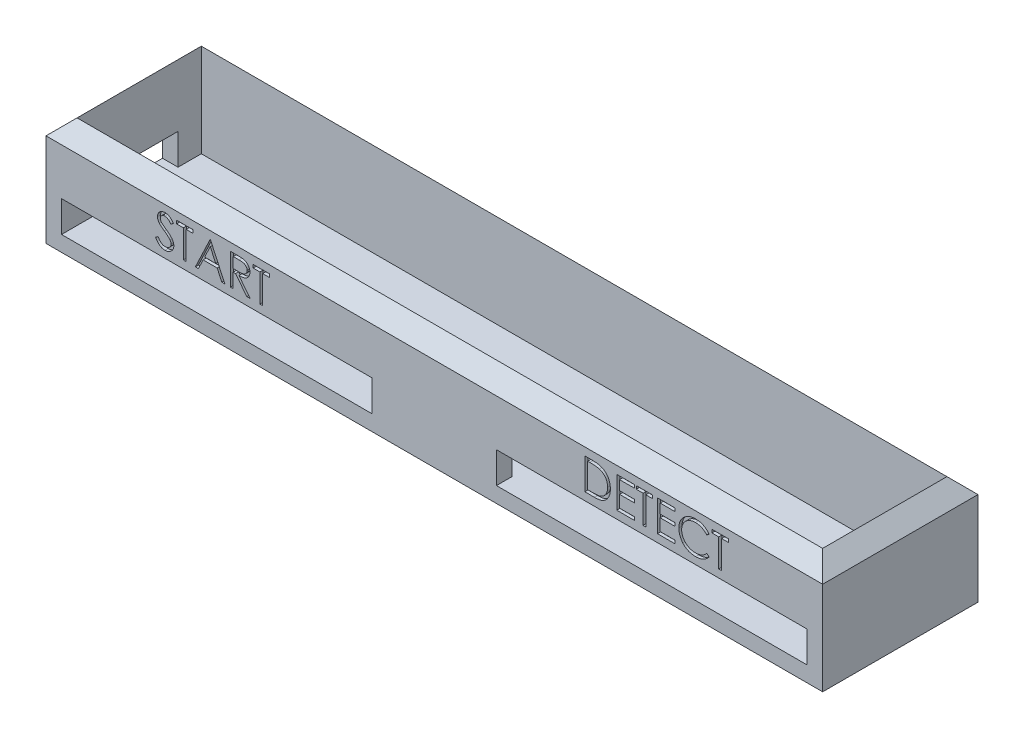
from build123d import *

# Parameters (mm, degrees)
SKETCH1_W            = 50
SKETCH1_H            = 10
BOSS_EXTRUDE1_DEPTH  = 8
SHELL1_T             = 1
CUT_EXTRUDE1_REACH   = 53.614
SKETCH2_W            = 20
SKETCH2_H            = 2
LPATTERN3_COUNT      = 2
LPATTERN3_PITCH      = 28
ARDUINO_CABLE_REACH  = 53.614
SKETCH3_W            = 5
SKETCH3_H            = 2
ARDUINO_DEBOSS_DEPTH = 0.2
DB15_LABELS_DEPTH    = 0.2
SKETCH6_W            = 50
SKETCH6_H            = 10
CUT_EXTRUDE5_DEPTH   = 1
CHAMFER1_SIZE        = 1


with BuildPart() as part:
    # Sketch1 → Boss-Extrude1 (new body)
    with BuildSketch(Plane(origin=(0, 0, 0), x_dir=(1, 0, 0), z_dir=(0, 1, 0))):
        with Locations((25, 5)):
            Rectangle(SKETCH1_W, SKETCH1_H)
    extrude(amount=BOSS_EXTRUDE1_DEPTH)

    # Shell1 (no face opened: a closed hollow body)
    add(offset(amount=-SHELL1_T, mode=Mode.PRIVATE), mode=Mode.SUBTRACT)

    # Sketch2 → Cut-Extrude1 (cut, up to next)
    with BuildSketch(Plane.XY, mode=Mode.PRIVATE) as cut_extrude1_sk1:
        with Locations((11, 2)):
            Rectangle(SKETCH2_W, SKETCH2_H)
    cut_extrude1_tool1 = extrude(cut_extrude1_sk1.sketch, amount=-CUT_EXTRUDE1_REACH, mode=Mode.PRIVATE) & part.part
    cut_extrude1 = cut_extrude1_tool1.solids().sort_by_distance((11, 2, 0))[0]
    add(cut_extrude1, mode=Mode.SUBTRACT)

    # LPattern3: Cut-Extrude1 ×2
    with Locations(*[(i * LPATTERN3_PITCH, 0, 0) for i in range(1, LPATTERN3_COUNT)]):
        add(cut_extrude1, mode=Mode.SUBTRACT)

    # Sketch3 → Arduino Cable (cut, up to next)
    with BuildSketch(Plane.ZY, mode=Mode.PRIVATE) as arduino_cable_sk1:
        with Locations((-5, 2)):
            Rectangle(SKETCH3_W, SKETCH3_H)
    arduino_cable_tool1 = extrude(arduino_cable_sk1.sketch, amount=-ARDUINO_CABLE_REACH, mode=Mode.PRIVATE) & part.part
    add(arduino_cable_tool1.solids().sort_by_distance((0, 2, -5))[0], mode=Mode.SUBTRACT)

    # Sketch4 → Arduino Deboss (cut)
    with BuildSketch(Plane.ZY):
        Polygon((-8.346153846, 3.5), (-8.08213141, 5.5), (-8.056490385, 5.5), (-7.230769231, 3.858974359), (-6.407451923, 5.5), (-6.381810897, 5.5), (-6.115384615, 3.5), (-6.294871795, 3.5), (-6.487179487, 4.937900641), (-7.208733974, 3.5), (-7.249599359, 3.5), (-7.974358974, 4.942307692), (-8.165464744, 3.5), align=None)
        with BuildLine():
            Line((-3.858974359, 5.133012821), (-4.016025641, 5.012820513))
            add(Edge.make_bspline(
                [(-4.016025641, 5.012820513), (-4.027229006, 5.026172496), (-4.04948469, 5.052696447), (-4.085289948, 5.089941901), (-4.122605173, 5.124836337), (-4.161416099, 5.157545982), (-4.20242131, 5.186926991), (-4.244627481, 5.214510478), (-4.28874065, 5.2392349), (-4.349741641, 5.269213749), (-4.429540411, 5.300497266), (-4.529994605, 5.326727684), (-4.63485809, 5.343425499), (-4.706399575, 5.34523398), (-4.742788462, 5.346153846)],
                knots=[0, 0, 0, 0, 0.757959112, 1.505699292, 2.245454638, 2.979532153, 3.711538275, 4.438200793, 5.171680507, 5.909471876, 7.393775596, 8.890124382, 10.418191784, 12, 12, 12, 12], degree=3))
            add(Edge.make_bspline(
                [(-4.742788462, 5.346153846), (-4.762836061, 5.34592301), (-4.8027452, 5.345463481), (-4.861972899, 5.339401124), (-4.920094642, 5.330880433), (-4.977072623, 5.318237391), (-5.032834314, 5.302253037), (-5.087744258, 5.283152801), (-5.141007458, 5.259521463), (-5.193360737, 5.233402458), (-5.243520286, 5.203901061), (-5.290980313, 5.171722003), (-5.335567723, 5.137225376), (-5.377317787, 5.100281887), (-5.416273186, 5.061057909), (-5.45215165, 5.019135428), (-5.484829027, 4.974648472), (-5.514953041, 4.928183668), (-5.541931746, 4.879876358), (-5.564520249, 4.829547747), (-5.584523176, 4.778059688), (-5.600351314, 4.724830453), (-5.61287961, 4.670234587), (-5.621523989, 4.614125565), (-5.627517401, 4.556620605), (-5.627974645, 4.517643855), (-5.628205128, 4.497996795)],
                knots=[0, 0, 0, 0, 1.054917814, 2.100044995, 3.131103042, 4.146048494, 5.169673617, 6.183595914, 7.203665975, 8.234915748, 9.262203917, 10.264457458, 11.251630812, 12.227803204, 13.197192746, 14.159520551, 15.12972552, 16.100847026, 17.073214652, 18.039054194, 19.002613845, 19.979014051, 20.95965708, 21.949030935, 22.966165397, 24, 24, 24, 24], degree=3))
            add(Edge.make_bspline(
                [(-5.628205128, 4.497996795), (-5.627484089, 4.468436041), (-5.626068423, 4.410397421), (-5.613469375, 4.325385643), (-5.594323609, 4.243945258), (-5.565628994, 4.166585348), (-5.530246679, 4.092352001), (-5.485537758, 4.022501228), (-5.43375688, 3.955977476), (-5.374171497, 3.894352935), (-5.308796745, 3.838059377), (-5.238655081, 3.788487617), (-5.163921203, 3.747164827), (-5.085420271, 3.712778571), (-5.002548206, 3.686346156), (-4.915454033, 3.667738085), (-4.824327179, 3.655599696), (-4.76205895, 3.654437589), (-4.73036859, 3.653846154)],
                knots=[0, 0, 0, 0, 1.029171465, 2.020641659, 2.987623507, 3.938342917, 4.889210282, 5.84687017, 6.821220943, 7.821438502, 8.827599549, 9.822697543, 10.807740252, 11.797342354, 12.80366471, 13.83203677, 14.896651826, 16, 16, 16, 16], degree=3))
            add(Edge.make_bspline(
                [(-4.73036859, 3.653846154), (-4.695452767, 3.654811171), (-4.626730077, 3.656710555), (-4.525948347, 3.672801555), (-4.429470767, 3.698891793), (-4.337292146, 3.735404892), (-4.249672348, 3.782870771), (-4.166474257, 3.840412415), (-4.087627645, 3.908577176), (-4.040215484, 3.960624678), (-4.016025641, 3.987179487)],
                knots=[0, 0, 0, 0, 1.028121516, 2.023589091, 2.998037872, 3.967518031, 4.937445131, 5.927275754, 6.942489185, 8, 8, 8, 8], degree=3))
            Line((-4.016025641, 3.987179487), (-3.858974359, 3.868189103))
            add(Edge.make_bspline(
                [(-3.858974359, 3.868189103), (-3.871613279, 3.851881416), (-3.896830579, 3.819344155), (-3.937663732, 3.773474607), (-3.98067933, 3.730329443), (-4.026196879, 3.690256517), (-4.07369276, 3.652453965), (-4.124019795, 3.617995776), (-4.176516385, 3.586400985), (-4.231004659, 3.557471314), (-4.287426723, 3.531804316), (-4.345714972, 3.509830734), (-4.405618158, 3.490902226), (-4.46713902, 3.47532969), (-4.530405167, 3.463174785), (-4.595188295, 3.455049257), (-4.661628223, 3.449482449), (-4.706451893, 3.448975068), (-4.729166667, 3.448717949)],
                knots=[0, 0, 0, 0, 0.986787822, 1.968848986, 2.935600012, 3.899624008, 4.868462664, 5.837806735, 6.815139263, 7.798259679, 8.787526145, 9.778297419, 10.776456485, 11.791383307, 12.812564526, 13.85620153, 14.913611965, 16, 16, 16, 16], degree=3))
            add(Edge.make_bspline(
                [(-4.729166667, 3.448717949), (-4.750677334, 3.448867659), (-4.793212014, 3.449163692), (-4.8560113, 3.453959216), (-4.917148204, 3.460501923), (-4.97644799, 3.470353426), (-5.034234261, 3.481978763), (-5.089983167, 3.497562339), (-5.144243287, 3.515019005), (-5.196796624, 3.535536141), (-5.247687881, 3.558688245), (-5.296752916, 3.58485485), (-5.343969164, 3.613815916), (-5.389800833, 3.644933064), (-5.43357088, 3.679205808), (-5.475658609, 3.716158171), (-5.516300024, 3.755665606), (-5.541444416, 3.784154093), (-5.554086538, 3.798477564)],
                knots=[0, 0, 0, 0, 1.114604814, 2.203992996, 3.262667896, 4.300477797, 5.318619304, 6.316056647, 7.298880507, 8.271930387, 9.238335007, 10.195173496, 11.151986948, 12.108099108, 13.064862484, 14.031167946, 15.010108607, 16, 16, 16, 16], degree=3))
            add(Edge.make_bspline(
                [(-5.554086538, 3.798477564), (-5.574335478, 3.823358243), (-5.614588893, 3.872819221), (-5.666089284, 3.952982639), (-5.710173601, 4.036678758), (-5.745816984, 4.124347289), (-5.773681403, 4.21579151), (-5.792984943, 4.311057518), (-5.805528717, 4.410056342), (-5.806963168, 4.47739165), (-5.807692308, 4.51161859)],
                knots=[0, 0, 0, 0, 0.994628077, 1.977248131, 2.950237994, 3.925870899, 4.908910175, 5.911660606, 6.938484602, 8, 8, 8, 8], degree=3))
            add(Edge.make_bspline(
                [(-5.807692308, 4.51161859), (-5.806803626, 4.547593135), (-5.805055199, 4.618370806), (-5.790200459, 4.722241636), (-5.766304004, 4.821756721), (-5.732362925, 4.91673029), (-5.689331295, 5.007661878), (-5.63617323, 5.093856853), (-5.573506292, 5.175866452), (-5.501821968, 5.25244631), (-5.423212062, 5.322468797), (-5.339029882, 5.384072342), (-5.249440198, 5.435339494), (-5.155429997, 5.478194444), (-5.056295322, 5.511134138), (-4.952247683, 5.534193101), (-4.843482589, 5.548545739), (-4.769275488, 5.550360144), (-4.731570513, 5.551282051)],
                knots=[0, 0, 0, 0, 1.032925535, 2.032216505, 3.007276963, 3.968222605, 4.92396291, 5.891752235, 6.871517503, 7.883894988, 8.900124299, 9.891468569, 10.874487609, 11.85992873, 12.854644235, 13.869047385, 14.917252991, 16, 16, 16, 16], degree=3))
            add(Edge.make_bspline(
                [(-4.731570513, 5.551282051), (-4.708590815, 5.551006544), (-4.663104816, 5.550461204), (-4.595817586, 5.545143409), (-4.530307685, 5.536278491), (-4.466529981, 5.524212165), (-4.4041742, 5.509236553), (-4.34371692, 5.489727811), (-4.284803384, 5.467421222), (-4.227805151, 5.44173067), (-4.172995694, 5.412892532), (-4.120392083, 5.381226461), (-4.070412164, 5.346771715), (-4.022704251, 5.309821329), (-3.978066416, 5.269593581), (-3.935231285, 5.227194955), (-3.895653526, 5.181404198), (-3.871223129, 5.149172808), (-3.858974359, 5.133012821)],
                knots=[0, 0, 0, 0, 1.096760587, 2.17092713, 3.219439832, 4.250915756, 5.268269357, 6.278326846, 7.281116186, 8.274029601, 9.260640565, 10.235837813, 11.203064059, 12.156899882, 13.114053108, 14.069676657, 15.032185724, 16, 16, 16, 16], degree=3))
        make_face()
        with BuildLine():
            Line((-3.448717949, 5.5), (-3.269230769, 5.5))
            Line((-3.269230769, 5.5), (-3.269230769, 4.301682692))
            add(Edge.make_bspline(
                [(-3.269230769, 4.301682692), (-3.26925748, 4.284722272), (-3.269308168, 4.252536951), (-3.268969589, 4.206726494), (-3.268021379, 4.165999374), (-3.267423573, 4.130198604), (-3.266093668, 4.099488463), (-3.26500907, 4.073702571), (-3.263614466, 4.052963027), (-3.261938399, 4.040859641), (-3.261217949, 4.035657051)],
                knots=[0, 0, 0, 0, 1.528628734, 2.90083645, 4.128790002, 5.200304208, 6.127813768, 6.898992206, 7.526736466, 8, 8, 8, 8], degree=3))
            add(Edge.make_bspline(
                [(-3.261217949, 4.035657051), (-3.258259401, 4.016887472), (-3.252509009, 3.980405913), (-3.237853936, 3.928458323), (-3.217386792, 3.881640347), (-3.193133625, 3.838491038), (-3.161172133, 3.800211403), (-3.122884398, 3.764947602), (-3.076497102, 3.734106571), (-3.024919613, 3.705906107), (-2.969328049, 3.683240345), (-2.912521611, 3.66610128), (-2.855354194, 3.655656194), (-2.8170821, 3.654446744), (-2.798076923, 3.653846154)],
                knots=[0, 0, 0, 0, 1.035780045, 2.013197591, 2.933192213, 3.817615948, 4.702609284, 5.640816605, 6.646850145, 7.73207398, 8.84249596, 9.914020372, 10.964143139, 12, 12, 12, 12], degree=3))
            add(Edge.make_bspline(
                [(-2.798076923, 3.653846154), (-2.7817605, 3.654459783), (-2.749221893, 3.655683496), (-2.700875361, 3.663261456), (-2.653789585, 3.676918923), (-2.607732054, 3.694541642), (-2.564560063, 3.717825979), (-2.524249524, 3.744723602), (-2.488270133, 3.776272674), (-2.455436992, 3.811187157), (-2.4268456, 3.850581328), (-2.40206209, 3.893597407), (-2.381761559, 3.940882748), (-2.371736688, 3.974113846), (-2.366586538, 3.991185897)],
                knots=[0, 0, 0, 0, 0.994687771, 1.983630487, 2.973142513, 3.978332533, 4.983357753, 5.956394766, 6.925816176, 7.893390482, 8.871859704, 9.88551698, 10.913711441, 12, 12, 12, 12], degree=3))
            add(Edge.make_bspline(
                [(-2.366586538, 3.991185897), (-2.364872181, 3.998242226), (-2.361051902, 4.013966569), (-2.357482162, 4.040550163), (-2.353764148, 4.071915514), (-2.351184393, 4.108287978), (-2.34866941, 4.149545677), (-2.347164797, 4.195903538), (-2.34646935, 4.24719323), (-2.346262104, 4.282985894), (-2.346153846, 4.301682692)],
                knots=[0, 0, 0, 0, 0.558680831, 1.244966039, 2.062412453, 2.990489873, 4.051219941, 5.244515665, 6.560634259, 8, 8, 8, 8], degree=3))
            Line((-2.346153846, 4.301682692), (-2.346153846, 5.5))
            Line((-2.346153846, 5.5), (-2.166666667, 5.5))
            Line((-2.166666667, 5.5), (-2.166666667, 4.292067308))
            add(Edge.make_bspline(
                [(-2.166666667, 4.292067308), (-2.166811878, 4.270296805), (-2.167095268, 4.227810347), (-2.16955274, 4.165552427), (-2.173471026, 4.106493581), (-2.179007076, 4.050625868), (-2.186342506, 3.998149206), (-2.194499775, 3.948603624), (-2.20488808, 3.902344771), (-2.217021452, 3.859011961), (-2.230892051, 3.817763096), (-2.248858421, 3.778615317), (-2.269100993, 3.740378517), (-2.293109366, 3.703631026), (-2.320087299, 3.668210138), (-2.350631116, 3.634330667), (-2.383730637, 3.601451212), (-2.419936099, 3.570415174), (-2.458650685, 3.541953073), (-2.499759232, 3.516925775), (-2.542945958, 3.495769423), (-2.588098601, 3.478354609), (-2.635236432, 3.465260552), (-2.684360637, 3.45550332), (-2.735583033, 3.44995915), (-2.77041998, 3.44913519), (-2.788060897, 3.448717949)],
                knots=[0, 0, 0, 0, 1.316592851, 2.569410997, 3.76748051, 4.895814652, 5.963796859, 6.97159953, 7.931736103, 8.829262218, 9.692595152, 10.560224239, 11.431080259, 12.30701507, 13.211635791, 14.121146779, 15.063487852, 16.031507147, 17.00238618, 17.966455255, 18.938106653, 19.907068911, 20.888905087, 21.893141452, 22.933117798, 24, 24, 24, 24], degree=3))
            add(Edge.make_bspline(
                [(-2.788060897, 3.448717949), (-2.807300385, 3.449166386), (-2.84504819, 3.450046218), (-2.900669942, 3.45508779), (-2.95399234, 3.464584015), (-3.005578556, 3.476675412), (-3.054726268, 3.493351833), (-3.102093951, 3.512836476), (-3.14687034, 3.536766339), (-3.189781842, 3.563391135), (-3.229681703, 3.593348071), (-3.26630879, 3.625999599), (-3.299723574, 3.660822672), (-3.329362829, 3.698194309), (-3.35571762, 3.737823856), (-3.378420599, 3.779823422), (-3.397913881, 3.824176745), (-3.407974777, 3.855007145), (-3.413060897, 3.870592949)],
                knots=[0, 0, 0, 0, 1.13879206, 2.234305948, 3.301075583, 4.341971843, 5.366689343, 6.369221514, 7.369726634, 8.367512178, 9.355451585, 10.318319045, 11.268648973, 12.207971039, 13.137398894, 14.081662264, 15.030215811, 16, 16, 16, 16], degree=3))
            add(Edge.make_bspline(
                [(-3.413060897, 3.870592949), (-3.416019274, 3.881240134), (-3.422436057, 3.904334116), (-3.429307656, 3.942554967), (-3.435084274, 3.986563491), (-3.440516021, 4.036362702), (-3.44372114, 4.091991197), (-3.446531105, 4.153424863), (-3.448737745, 4.220737984), (-3.448724732, 4.267626279), (-3.448717949, 4.292067308)],
                knots=[0, 0, 0, 0, 0.625038921, 1.35572334, 2.194682327, 3.136881307, 4.189498639, 5.346923369, 6.617055217, 8, 8, 8, 8], degree=3))
            Line((-3.448717949, 4.292067308), (-3.448717949, 5.5))
        make_face()
    extrude(amount=-ARDUINO_DEBOSS_DEPTH, mode=Mode.SUBTRACT)

    # Sketch5 → DB15 Labels (cut)
    # profile 1 of 11: a face of its own
    with BuildSketch(Plane.XY):
        with BuildLine():
            Line((7.051282051, 3.885817308), (7.220352564, 3.987179487))
            add(Edge.make_bspline(
                [(7.220352564, 3.987179487), (7.236077271, 3.960856981), (7.266205203, 3.910424076), (7.316463122, 3.842276625), (7.368539072, 3.784355392), (7.422818691, 3.736997331), (7.478970661, 3.699712253), (7.537361549, 3.673310977), (7.597794584, 3.656844706), (7.638922482, 3.654844656), (7.659455128, 3.653846154)],
                knots=[0, 0, 0, 0, 1.272034388, 2.437168799, 3.508375237, 4.49857839, 5.41946034, 6.295179144, 7.148887113, 8, 8, 8, 8], degree=3))
            add(Edge.make_bspline(
                [(7.659455128, 3.653846154), (7.676990477, 3.654334538), (7.711754347, 3.655302761), (7.762932772, 3.664606077), (7.812636659, 3.678898722), (7.859841595, 3.699367825), (7.903896232, 3.724132674), (7.942528629, 3.754044776), (7.975926408, 3.787534036), (8.003245902, 3.824895553), (8.024205922, 3.865076781), (8.040315676, 3.906320182), (8.049255718, 3.949273649), (8.050602434, 3.978193914), (8.051282051, 3.992788462)],
                knots=[0, 0, 0, 0, 1.095163259, 2.171163733, 3.241058638, 4.321873601, 5.38011039, 6.391990106, 7.366004449, 8.327778327, 9.272591725, 10.192022065, 11.087607919, 12, 12, 12, 12], degree=3))
            add(Edge.make_bspline(
                [(8.051282051, 3.992788462), (8.050439588, 4.009440376), (8.048726983, 4.043291284), (8.034251852, 4.093233943), (8.011480854, 4.142658268), (7.990473629, 4.17323042), (7.979567308, 4.189102564)],
                knots=[0, 0, 0, 0, 0.938893495, 1.908633276, 2.914225137, 4, 4, 4, 4], degree=3))
            add(Edge.make_bspline(
                [(7.979567308, 4.189102564), (7.970612671, 4.200557892), (7.951813531, 4.22460692), (7.919494953, 4.260404197), (7.881571459, 4.297329008), (7.839340856, 4.336791326), (7.791264805, 4.376955781), (7.738849083, 4.419737654), (7.680755449, 4.463509984), (7.64001288, 4.492865736), (7.618990385, 4.508012821)],
                knots=[0, 0, 0, 0, 0.722233717, 1.516239348, 2.393582979, 3.351407094, 4.387010283, 5.505090956, 6.712668013, 8, 8, 8, 8], degree=3))
            add(Edge.make_bspline(
                [(7.618990385, 4.508012821), (7.597948101, 4.523000585), (7.557716857, 4.551656049), (7.50145481, 4.594184211), (7.451143689, 4.633066422), (7.407007108, 4.668668715), (7.369064481, 4.700995918), (7.337016817, 4.729737597), (7.311680499, 4.755671061), (7.297591596, 4.772494685), (7.291266026, 4.780048077)],
                knots=[0, 0, 0, 0, 1.452282411, 2.77665338, 3.964542531, 5.026858415, 5.96415736, 6.766646006, 7.446254459, 8, 8, 8, 8], degree=3))
            add(Edge.make_bspline(
                [(7.291266026, 4.780048077), (7.282424571, 4.791820098), (7.265036665, 4.814971357), (7.242084661, 4.85115699), (7.222576568, 4.888198856), (7.207283807, 4.926196493), (7.194405968, 4.964616452), (7.185744293, 5.003960021), (7.180320638, 5.044050661), (7.179765217, 5.071029804), (7.179487179, 5.084535256)],
                knots=[0, 0, 0, 0, 1.068054152, 2.10047183, 3.106115577, 4.101338837, 5.06977816, 6.043150881, 7.020423561, 8, 8, 8, 8], degree=3))
            add(Edge.make_bspline(
                [(7.179487179, 5.084535256), (7.180233013, 5.105695128), (7.181708739, 5.147562593), (7.194189035, 5.208723067), (7.213887831, 5.267115306), (7.24148491, 5.322161211), (7.27706054, 5.372427485), (7.318229668, 5.418492335), (7.367264803, 5.457217239), (7.421066302, 5.491052701), (7.479955658, 5.517536087), (7.541664745, 5.53751379), (7.606291644, 5.548833366), (7.650064863, 5.550457803), (7.672275641, 5.551282051)],
                knots=[0, 0, 0, 0, 1.005424448, 1.989358655, 2.955360095, 3.929531133, 4.905563448, 5.876582895, 6.856512386, 7.866279853, 8.892233794, 9.918561126, 10.94386622, 12, 12, 12, 12], degree=3))
            add(Edge.make_bspline(
                [(7.672275641, 5.551282051), (7.695843698, 5.550469165), (7.742713042, 5.548852593), (7.811655451, 5.53479686), (7.878033003, 5.511539334), (7.931429155, 5.485145815), (7.973219304, 5.458785006), (8.005089437, 5.434773678), (8.037385123, 5.407130758), (8.070366869, 5.375782618), (8.103475817, 5.340441617), (8.137203504, 5.301349795), (8.171628801, 5.258746049), (8.193775006, 5.228332048), (8.205128205, 5.212740385)],
                knots=[0, 0, 0, 0, 1.286793592, 2.559021753, 3.825965368, 5.121522368, 5.803751409, 6.523245864, 7.299691795, 8.125521123, 9.008227632, 9.944561021, 10.946284179, 12, 12, 12, 12], degree=3))
            Line((8.205128205, 5.212740385), (8.04286859, 5.08974359))
            add(Edge.make_bspline(
                [(8.04286859, 5.08974359), (8.033070914, 5.102365699), (8.014202881, 5.126672929), (7.98555746, 5.160713681), (7.958558233, 5.191808812), (7.931958005, 5.218817456), (7.907161644, 5.243218676), (7.883094762, 5.264109965), (7.860103705, 5.28169602), (7.831122613, 5.300463768), (7.794712488, 5.319067485), (7.749007039, 5.334809815), (7.701243453, 5.34426985), (7.668712235, 5.345520643), (7.65224359, 5.346153846)],
                knots=[0, 0, 0, 0, 1.181633172, 2.275549214, 3.290209073, 4.226197932, 5.078386478, 5.862611352, 6.581680152, 7.217281963, 8.414376989, 9.595101626, 10.782541182, 12, 12, 12, 12], degree=3))
            add(Edge.make_bspline(
                [(7.65224359, 5.346153846), (7.63158272, 5.345461446), (7.591740178, 5.344126218), (7.535174329, 5.329543369), (7.484263515, 5.306582306), (7.440519192, 5.274402319), (7.404098062, 5.236276037), (7.377752086, 5.192402406), (7.361894849, 5.143955319), (7.359959832, 5.110160086), (7.358974359, 5.092948718)],
                knots=[0, 0, 0, 0, 1.14458467, 2.207223713, 3.21896685, 4.227309161, 5.202851033, 6.127160689, 7.046193047, 8, 8, 8, 8], degree=3))
            add(Edge.make_bspline(
                [(7.358974359, 5.092948718), (7.359199003, 5.082233587), (7.359648658, 5.060785805), (7.365919971, 5.029099278), (7.37397673, 4.997492798), (7.386743948, 4.966108465), (7.404369836, 4.934397403), (7.427515651, 4.901813553), (7.456666115, 4.868069719), (7.478995836, 4.846122649), (7.490785256, 4.834535256)],
                knots=[0, 0, 0, 0, 0.858281714, 1.717966888, 2.583508476, 3.4729293, 4.427298488, 5.488583878, 6.674047936, 8, 8, 8, 8], degree=3))
            add(Edge.make_bspline(
                [(7.490785256, 4.834535256), (7.495163184, 4.830628385), (7.505564136, 4.821346551), (7.524578951, 4.806150962), (7.549689121, 4.787406521), (7.580238951, 4.764213769), (7.616791729, 4.737310076), (7.659351475, 4.707039441), (7.707443779, 4.672419178), (7.741570589, 4.648214869), (7.759615385, 4.635416667)],
                knots=[0, 0, 0, 0, 0.420754252, 0.999615792, 1.744751191, 2.668019286, 3.750313428, 4.999500688, 6.413464383, 8, 8, 8, 8], degree=3))
            add(Edge.make_bspline(
                [(7.759615385, 4.635416667), (7.781321621, 4.619621604), (7.823352739, 4.589036654), (7.88315707, 4.543084837), (7.937382103, 4.498143255), (7.98621822, 4.454498908), (8.030147882, 4.412482855), (8.068683722, 4.371589609), (8.102218396, 4.332112139), (8.138320807, 4.281499239), (8.17521099, 4.219338619), (8.206891851, 4.143179626), (8.22686805, 4.066724586), (8.229480344, 4.015337822), (8.230769231, 3.989983974)],
                knots=[0, 0, 0, 0, 1.163667725, 2.253281268, 3.268753668, 4.215851969, 5.092017293, 5.902905408, 6.650798638, 7.335211899, 8.59617414, 9.77448103, 10.901945474, 12, 12, 12, 12], degree=3))
            add(Edge.make_bspline(
                [(8.230769231, 3.989983974), (8.230393723, 3.97205348), (8.22965, 3.936540689), (8.221100907, 3.884394931), (8.208575384, 3.83374872), (8.189696964, 3.785228084), (8.16665516, 3.737945363), (8.137417304, 3.693140848), (8.103527198, 3.649822906), (8.064650761, 3.609146625), (8.022110246, 3.571805942), (7.977148134, 3.538589335), (7.929690835, 3.510893151), (7.879995797, 3.488292669), (7.828051605, 3.470616374), (7.773875728, 3.45780902), (7.717378865, 3.449948614), (7.67897859, 3.44913275), (7.659455128, 3.448717949)],
                knots=[0, 0, 0, 0, 0.983748083, 1.948392443, 2.894712957, 3.844097841, 4.80183111, 5.778335162, 6.776009319, 7.81870978, 8.863265674, 9.881300176, 10.883814829, 11.87499822, 12.874611388, 13.892143829, 14.928324115, 16, 16, 16, 16], degree=3))
            add(Edge.make_bspline(
                [(7.659455128, 3.448717949), (7.644349218, 3.449010052), (7.614327641, 3.449590581), (7.569922223, 3.454722742), (7.526413886, 3.461983944), (7.484348582, 3.473511984), (7.443184347, 3.487498828), (7.403100213, 3.504720732), (7.364076753, 3.525359133), (7.325895277, 3.54895629), (7.288652892, 3.576417858), (7.25269891, 3.608402713), (7.216853661, 3.644028716), (7.182175149, 3.684263324), (7.147961924, 3.728456514), (7.114888547, 3.777021761), (7.082270423, 3.829694535), (7.061804441, 3.866760298), (7.051282051, 3.885817308)],
                knots=[0, 0, 0, 0, 0.915332311, 1.819136955, 2.706846663, 3.586547465, 4.459518054, 5.340707479, 6.227863349, 7.133153174, 8.059268498, 9.028702269, 10.047606654, 11.120612155, 12.245963614, 13.433783089, 14.680604001, 16, 16, 16, 16], degree=3))
        make_face()
    # profile 2 of 11: a face of its own
    with BuildSketch(Plane.XY):
        Polygon((8.41025641, 5.294871795), (8.41025641, 5.5), (9.461538462, 5.5), (9.461538462, 5.294871795), (9.025641026, 5.294871795), (9.025641026, 3.5), (8.846153846, 3.5), (8.846153846, 5.294871795), align=None)
    # profile 3 of 11: a face of its own
    with BuildSketch(Plane.XY):
        Polygon((10.58974359, 5.5), (11.512820513, 3.5), (11.317708333, 3.5), (11.022035256, 4.141025641), (10.115384615, 4.141025641), (9.811698718, 3.5), (9.615384615, 3.5), (10.564102564, 5.5), align=None)
        Polygon((10.574919872, 5.109775641), (10.213141026, 4.346153846), (10.927483974, 4.346153846), align=None, mode=Mode.SUBTRACT)
    # profile 4 of 11: a face of its own
    with BuildSketch(Plane.XY):
        with BuildLine():
            Line((11.871794872, 5.5), (12.272035256, 5.5))
            add(Edge.make_bspline(
                [(12.272035256, 5.5), (12.298744473, 5.499911094), (12.350029127, 5.499740384), (12.423499567, 5.498788519), (12.490257908, 5.496060316), (12.550269245, 5.493712554), (12.603532476, 5.489431445), (12.650210928, 5.485339646), (12.690089612, 5.479983269), (12.714230099, 5.475008741), (12.725160256, 5.47275641)],
                knots=[0, 0, 0, 0, 1.410062039, 2.707475311, 3.878576406, 4.937260626, 5.877586885, 6.699081471, 7.410979367, 8, 8, 8, 8], degree=3))
            add(Edge.make_bspline(
                [(12.725160256, 5.47275641), (12.739792613, 5.469141116), (12.768745178, 5.461987651), (12.81043093, 5.446867879), (12.850153401, 5.429370951), (12.887747587, 5.408820253), (12.923025182, 5.385063236), (12.956349931, 5.358510023), (12.987873053, 5.329305906), (13.016319698, 5.296714568), (13.043142014, 5.262522277), (13.065764086, 5.225548701), (13.085264931, 5.186884971), (13.100790941, 5.146137875), (13.11329264, 5.103702577), (13.122107634, 5.059194693), (13.127394027, 5.012816993), (13.12793223, 4.981183903), (13.128205128, 4.965144231)],
                knots=[0, 0, 0, 0, 1.027469482, 2.033020251, 3.019912614, 3.986113645, 4.951240523, 5.91722682, 6.890402269, 7.87763091, 8.8651537, 9.85103654, 10.82876324, 11.815024772, 12.821070561, 13.842952187, 14.906261191, 16, 16, 16, 16], degree=3))
            add(Edge.make_bspline(
                [(13.128205128, 4.965144231), (13.127365701, 4.9384956), (13.12572776, 4.886497218), (13.110456272, 4.811033857), (13.085441118, 4.740639963), (13.050970667, 4.67540417), (13.007073824, 4.616598087), (12.954316801, 4.564946398), (12.892670166, 4.521723591), (12.835281985, 4.49175056), (12.784588157, 4.472554612), (12.742854835, 4.459048121), (12.697330848, 4.448612712), (12.648452371, 4.439264066), (12.596015996, 4.432205955), (12.540147402, 4.427036472), (12.480806744, 4.423805587), (12.440041562, 4.423324441), (12.419070513, 4.423076923)],
                knots=[0, 0, 0, 0, 1.260483769, 2.459530307, 3.627416485, 4.787058657, 5.939039949, 7.08810263, 8.267026773, 9.491475466, 10.141966685, 10.831826277, 11.566392101, 12.351337768, 13.187381173, 14.07005841, 15.007169909, 16, 16, 16, 16], degree=3))
            Line((12.419070513, 4.423076923), (13.153846154, 3.5))
            Line((13.153846154, 3.5), (12.931891026, 3.5))
            Line((12.931891026, 3.5), (12.197115385, 4.423076923))
            Line((12.197115385, 4.423076923), (12.051282051, 4.423076923))
            Line((12.051282051, 4.423076923), (12.051282051, 3.5))
            Line((12.051282051, 3.5), (11.871794872, 3.5))
            Line((11.871794872, 3.5), (11.871794872, 5.5))
        make_face()
        with BuildLine():
            Line((12.051282051, 5.294871795), (12.051282051, 4.628205128))
            Line((12.051282051, 4.628205128), (12.417467949, 4.625400641))
            add(Edge.make_bspline(
                [(12.417467949, 4.625400641), (12.434565114, 4.625393077), (12.467704289, 4.625378416), (12.515647526, 4.627660574), (12.56028759, 4.630256756), (12.601453734, 4.634227811), (12.639164349, 4.639345566), (12.673400585, 4.645747271), (12.704218329, 4.653205593), (12.740160351, 4.664749379), (12.780295512, 4.683038532), (12.823913489, 4.709647389), (12.861057682, 4.743115457), (12.892439317, 4.781386003), (12.917656135, 4.82346386), (12.935434452, 4.868844642), (12.946715848, 4.916382698), (12.948046445, 4.949055902), (12.948717949, 4.965544872)],
                knots=[0, 0, 0, 0, 1.146690395, 2.22261258, 3.21895312, 4.145990853, 4.996080663, 5.770904154, 6.481378293, 7.121626537, 8.300444488, 9.431385265, 10.535395872, 11.636531494, 12.74115979, 13.810798291, 14.895190096, 16, 16, 16, 16], degree=3))
            add(Edge.make_bspline(
                [(12.948717949, 4.965544872), (12.948031022, 4.981628628), (12.946669785, 5.013500765), (12.935556203, 5.060161285), (12.916762271, 5.104199542), (12.891435278, 5.145436391), (12.860578618, 5.18286824), (12.82439701, 5.214895184), (12.783879756, 5.24132345), (12.7460105, 5.258211667), (12.712162378, 5.268565869), (12.682774001, 5.275852248), (12.649567443, 5.281706231), (12.612381466, 5.286396551), (12.57137482, 5.290427948), (12.526340162, 5.29314325), (12.477576288, 5.294751172), (12.443778042, 5.294830652), (12.426282051, 5.294871795)],
                knots=[0, 0, 0, 0, 1.101028733, 2.181837193, 3.264309656, 4.369019818, 5.486613113, 6.575447106, 7.666700264, 8.788928104, 9.402425223, 10.0903467, 10.862060571, 11.710948788, 12.657782767, 13.684531032, 14.801375019, 16, 16, 16, 16], degree=3))
            Line((12.426282051, 5.294871795), (12.051282051, 5.294871795))
        make_face(mode=Mode.SUBTRACT)
    # profile 5 of 11: a face of its own
    with BuildSketch(Plane.XY):
        Polygon((13.333333333, 5.294871795), (13.333333333, 5.5), (14.384615385, 5.5), (14.384615385, 5.294871795), (13.948717949, 5.294871795), (13.948717949, 3.5), (13.769230769, 3.5), (13.769230769, 5.294871795), align=None)
    # profile 6 of 11: a face of its own
    with BuildSketch(Plane.XY):
        with BuildLine():
            Line((34.692307692, 3.5), (34.692307692, 5.5))
            Line((34.692307692, 5.5), (35.096153846, 5.5))
            add(Edge.make_bspline(
                [(35.096153846, 5.5), (35.131278982, 5.499747103), (35.199140562, 5.499258507), (35.297204818, 5.496160569), (35.387938397, 5.490680303), (35.471042888, 5.482697717), (35.546746437, 5.472895983), (35.614837071, 5.460610038), (35.675666866, 5.446102512), (35.713077975, 5.433733683), (35.730769231, 5.427884615)],
                knots=[0, 0, 0, 0, 1.314313732, 2.53924729, 3.670748893, 4.714932338, 5.66265055, 6.526160246, 7.303039223, 8, 8, 8, 8], degree=3))
            add(Edge.make_bspline(
                [(35.730769231, 5.427884615), (35.753909082, 5.419067069), (35.799664049, 5.40163193), (35.864810976, 5.368742615), (35.926139755, 5.331477985), (35.983979266, 5.289788921), (36.03700831, 5.242495007), (36.087298537, 5.191605244), (36.132792664, 5.13526905), (36.174454548, 5.074654771), (36.212017782, 5.010476455), (36.244668729, 4.942856393), (36.271785297, 4.872137989), (36.294295712, 4.798517904), (36.312036545, 4.72183426), (36.324140506, 4.641997765), (36.332123929, 4.559323942), (36.332926244, 4.503224249), (36.333333333, 4.474759615)],
                knots=[0, 0, 0, 0, 0.984719456, 1.947108742, 2.898477687, 3.838006223, 4.779231079, 5.722358779, 6.681677486, 7.655904652, 8.64651281, 9.637519902, 10.640069247, 11.656948941, 12.698408672, 13.768548281, 14.867775369, 16, 16, 16, 16], degree=3))
            add(Edge.make_bspline(
                [(36.333333333, 4.474759615), (36.332973923, 4.450038908), (36.332265668, 4.401324171), (36.325906059, 4.329529374), (36.316662448, 4.259864476), (36.302351478, 4.192661219), (36.284978613, 4.127330808), (36.262713384, 4.064569526), (36.237207386, 4.003801635), (36.207464598, 3.945848791), (36.174812378, 3.890944007), (36.139771382, 3.839186563), (36.102378985, 3.791315007), (36.062278623, 3.747184372), (36.019988499, 3.706861184), (35.975231739, 3.670008604), (35.927892853, 3.637347716), (35.878183868, 3.607595082), (35.824654652, 3.581640593), (35.766291299, 3.559680588), (35.702844912, 3.541482522), (35.634471222, 3.526299153), (35.561052092, 3.51425498), (35.48251554, 3.506182756), (35.398982232, 3.500723937), (35.341622652, 3.500245998), (35.312099359, 3.5)],
                knots=[0, 0, 0, 0, 1.105936401, 2.179363191, 3.223086493, 4.248585256, 5.251745608, 6.245858792, 7.225916811, 8.198733463, 9.158002045, 10.082870192, 10.993790845, 11.873723703, 12.748670949, 13.606408763, 14.465103618, 15.319838547, 16.196477973, 17.123216899, 18.106603292, 19.147568657, 20.255746949, 21.433717677, 22.679120308, 24, 24, 24, 24], degree=3))
            Line((35.312099359, 3.5), (34.692307692, 3.5))
        make_face()
        with BuildLine():
            Line((34.871794872, 3.705128205), (35.101362179, 3.705128205))
            add(Edge.make_bspline(
                [(35.101362179, 3.705128205), (35.13434982, 3.705269974), (35.197797133, 3.705542649), (35.289030275, 3.707935336), (35.37238993, 3.711845015), (35.447887935, 3.717316488), (35.515481663, 3.724555697), (35.575312377, 3.73262707), (35.627183954, 3.742682756), (35.658572203, 3.75179759), (35.673076923, 3.756009615)],
                knots=[0, 0, 0, 0, 1.375205317, 2.645023457, 3.804390687, 4.853969522, 5.800190428, 6.637939096, 7.370582563, 8, 8, 8, 8], degree=3))
            add(Edge.make_bspline(
                [(35.673076923, 3.756009615), (35.69133313, 3.762439077), (35.727409495, 3.775144433), (35.779341543, 3.79832024), (35.827774117, 3.825772851), (35.873551275, 3.856288436), (35.916023649, 3.890943294), (35.955694573, 3.92898386), (35.992484174, 3.970603731), (36.02601235, 4.015751252), (36.056017095, 4.064145421), (36.082000654, 4.115310469), (36.104772958, 4.168685789), (36.12264644, 4.225091022), (36.136655345, 4.284021913), (36.146578024, 4.345482606), (36.152757866, 4.409461624), (36.153478694, 4.452977124), (36.153846154, 4.475160256)],
                knots=[0, 0, 0, 0, 0.998632004, 1.973411704, 2.929992603, 3.868527914, 4.809262121, 5.754881198, 6.702106254, 7.672490631, 8.653608572, 9.636854334, 10.631411391, 11.644891563, 12.686317036, 13.754757253, 14.855430412, 16, 16, 16, 16], degree=3))
            add(Edge.make_bspline(
                [(36.153846154, 4.475160256), (36.153552847, 4.498550817), (36.152976642, 4.544501779), (36.145734179, 4.611925034), (36.135150433, 4.67677112), (36.11984547, 4.739044374), (36.100342111, 4.79886629), (36.076002315, 4.85590601), (36.048192819, 4.910765935), (36.015105197, 4.962179858), (35.978867716, 5.010804492), (35.938651785, 5.055350158), (35.895096334, 5.095918329), (35.84867642, 5.133140794), (35.798083792, 5.165520037), (35.744510254, 5.194483855), (35.687169871, 5.219064364), (35.647276902, 5.232138), (35.627003205, 5.238782051)],
                knots=[0, 0, 0, 0, 1.122418816, 2.205001699, 3.251619955, 4.274784885, 5.280384055, 6.268708349, 7.249350384, 8.229342522, 9.199999885, 10.157847722, 11.105861043, 12.055065948, 13.010012805, 13.98527497, 14.976112212, 16, 16, 16, 16], degree=3))
            add(Edge.make_bspline(
                [(35.627003205, 5.238782051), (35.610231121, 5.24342001), (35.57456907, 5.253281583), (35.51637509, 5.264038939), (35.450880719, 5.273527224), (35.377795176, 5.281560389), (35.297201771, 5.287324573), (35.20903852, 5.291651038), (35.113267318, 5.294569114), (35.046877298, 5.294768375), (35.012419872, 5.294871795)],
                knots=[0, 0, 0, 0, 0.674548936, 1.434276114, 2.292660221, 3.240891867, 4.284742987, 5.42552168, 6.663806718, 8, 8, 8, 8], degree=3))
            Line((35.012419872, 5.294871795), (34.871794872, 5.294871795))
            Line((34.871794872, 5.294871795), (34.871794872, 3.705128205))
        make_face(mode=Mode.SUBTRACT)
    # profile 7 of 11: a face of its own
    with BuildSketch(Plane.XY):
        Polygon((36.743589744, 5.5), (37.871794872, 5.5), (37.871794872, 5.294871795), (36.923076923, 5.294871795), (36.923076923, 4.679487179), (37.871794872, 4.679487179), (37.871794872, 4.474358974), (36.923076923, 4.474358974), (36.923076923, 3.705128205), (37.871794872, 3.705128205), (37.871794872, 3.5), (36.743589744, 3.5), align=None)
    # profile 8 of 11: a face of its own
    with BuildSketch(Plane.XY):
        Polygon((38, 5.294871795), (38, 5.5), (39.051282051, 5.5), (39.051282051, 5.294871795), (38.615384615, 5.294871795), (38.615384615, 3.5), (38.435897436, 3.5), (38.435897436, 5.294871795), align=None)
    # profile 9 of 11: a face of its own
    with BuildSketch(Plane.XY):
        Polygon((39.358974359, 5.5), (40.487179487, 5.5), (40.487179487, 5.294871795), (39.538461538, 5.294871795), (39.538461538, 4.679487179), (40.487179487, 4.679487179), (40.487179487, 4.474358974), (39.538461538, 4.474358974), (39.538461538, 3.705128205), (40.487179487, 3.705128205), (40.487179487, 3.5), (39.358974359, 3.5), align=None)
    # profile 10 of 11: a face of its own
    with BuildSketch(Plane.XY):
        with BuildLine():
            Line((42.692307692, 5.133012821), (42.53525641, 5.012820513))
            add(Edge.make_bspline(
                [(42.53525641, 5.012820513), (42.524053045, 5.026172496), (42.501797362, 5.052696447), (42.465992103, 5.089941901), (42.428676878, 5.124836337), (42.389865952, 5.157545982), (42.348860741, 5.186926991), (42.30665457, 5.214510478), (42.262541402, 5.2392349), (42.20154041, 5.269213749), (42.12174164, 5.300497266), (42.021287446, 5.326727684), (41.916423961, 5.343425499), (41.844882476, 5.34523398), (41.80849359, 5.346153846)],
                knots=[0, 0, 0, 0, 0.757959112, 1.505699292, 2.245454638, 2.979532153, 3.711538275, 4.438200793, 5.171680507, 5.909471876, 7.393775596, 8.890124382, 10.418191784, 12, 12, 12, 12], degree=3))
            add(Edge.make_bspline(
                [(41.80849359, 5.346153846), (41.78844599, 5.34592301), (41.748536852, 5.345463481), (41.689309152, 5.339401124), (41.631187409, 5.330880433), (41.574209428, 5.318237391), (41.518447738, 5.302253037), (41.463537794, 5.283152801), (41.410274594, 5.259521463), (41.357921315, 5.233402458), (41.307761766, 5.203901061), (41.260301738, 5.171722003), (41.215714328, 5.137225376), (41.173964264, 5.100281887), (41.135008865, 5.061057909), (41.099130402, 5.019135428), (41.066453024, 4.974648472), (41.03632901, 4.928183668), (41.009350305, 4.879876358), (40.986761803, 4.829547747), (40.966758876, 4.778059688), (40.950930737, 4.724830453), (40.938402442, 4.670234587), (40.929758063, 4.614125565), (40.923764651, 4.556620605), (40.923307407, 4.517643855), (40.923076923, 4.497996795)],
                knots=[0, 0, 0, 0, 1.054917814, 2.100044995, 3.131103042, 4.146048494, 5.169673617, 6.183595914, 7.203665975, 8.234915748, 9.262203917, 10.264457458, 11.251630812, 12.227803204, 13.197192746, 14.159520551, 15.12972552, 16.100847026, 17.073214652, 18.039054194, 19.002613845, 19.979014051, 20.95965708, 21.949030935, 22.966165397, 24, 24, 24, 24], degree=3))
            add(Edge.make_bspline(
                [(40.923076923, 4.497996795), (40.923797963, 4.468436041), (40.925213628, 4.410397421), (40.937812676, 4.325385643), (40.956958442, 4.243945258), (40.985653058, 4.166585348), (41.021035372, 4.092352001), (41.065744293, 4.022501228), (41.117525172, 3.955977476), (41.177110554, 3.894352935), (41.242485306, 3.838059377), (41.31262697, 3.788487617), (41.387360849, 3.747164827), (41.46586178, 3.712778571), (41.548733845, 3.686346156), (41.635828018, 3.667738085), (41.726954873, 3.655599696), (41.789223101, 3.654437589), (41.820913462, 3.653846154)],
                knots=[0, 0, 0, 0, 1.029171465, 2.020641659, 2.987623507, 3.938342917, 4.889210282, 5.84687017, 6.821220943, 7.821438502, 8.827599549, 9.822697543, 10.807740252, 11.797342354, 12.80366471, 13.83203677, 14.896651826, 16, 16, 16, 16], degree=3))
            add(Edge.make_bspline(
                [(41.820913462, 3.653846154), (41.855829284, 3.654811171), (41.924551975, 3.656710555), (42.025333704, 3.672801555), (42.121811284, 3.698891793), (42.213989905, 3.735404892), (42.301609703, 3.782870771), (42.384807795, 3.840412415), (42.463654406, 3.908577176), (42.511066568, 3.960624678), (42.53525641, 3.987179487)],
                knots=[0, 0, 0, 0, 1.028121516, 2.023589091, 2.998037872, 3.967518031, 4.937445131, 5.927275754, 6.942489185, 8, 8, 8, 8], degree=3))
            Line((42.53525641, 3.987179487), (42.692307692, 3.868189103))
            add(Edge.make_bspline(
                [(42.692307692, 3.868189103), (42.679668772, 3.851881416), (42.654451472, 3.819344155), (42.61361832, 3.773474607), (42.570602721, 3.730329443), (42.525085173, 3.690256517), (42.477589292, 3.652453965), (42.427262256, 3.617995776), (42.374765666, 3.586400985), (42.320277392, 3.557471314), (42.263855328, 3.531804316), (42.205567079, 3.509830734), (42.145663893, 3.490902226), (42.084143031, 3.47532969), (42.020876885, 3.463174785), (41.956093757, 3.455049257), (41.889653828, 3.449482449), (41.844830159, 3.448975068), (41.822115385, 3.448717949)],
                knots=[0, 0, 0, 0, 0.986787822, 1.968848986, 2.935600012, 3.899624008, 4.868462664, 5.837806735, 6.815139263, 7.798259679, 8.787526145, 9.778297419, 10.776456485, 11.791383307, 12.812564526, 13.85620153, 14.913611965, 16, 16, 16, 16], degree=3))
            add(Edge.make_bspline(
                [(41.822115385, 3.448717949), (41.800604718, 3.448867659), (41.758070038, 3.449163692), (41.695270751, 3.453959216), (41.634133848, 3.460501923), (41.574834062, 3.470353426), (41.51704779, 3.481978763), (41.461298885, 3.497562339), (41.407038764, 3.515019005), (41.354485427, 3.535536141), (41.30359417, 3.558688245), (41.254529135, 3.58485485), (41.207312888, 3.613815916), (41.161481219, 3.644933064), (41.117711171, 3.679205808), (41.075623442, 3.716158171), (41.034982027, 3.755665606), (41.009837636, 3.784154093), (40.997195513, 3.798477564)],
                knots=[0, 0, 0, 0, 1.114604814, 2.203992996, 3.262667896, 4.300477797, 5.318619304, 6.316056647, 7.298880507, 8.271930387, 9.238335007, 10.195173496, 11.151986948, 12.108099108, 13.064862484, 14.031167946, 15.010108607, 16, 16, 16, 16], degree=3))
            add(Edge.make_bspline(
                [(40.997195513, 3.798477564), (40.976946574, 3.823358243), (40.936693158, 3.872819221), (40.885192768, 3.952982639), (40.84110845, 4.036678758), (40.805465067, 4.124347289), (40.777600648, 4.21579151), (40.758297108, 4.311057518), (40.745753334, 4.410056342), (40.744318883, 4.47739165), (40.743589744, 4.51161859)],
                knots=[0, 0, 0, 0, 0.994628077, 1.977248131, 2.950237994, 3.925870899, 4.908910175, 5.911660606, 6.938484602, 8, 8, 8, 8], degree=3))
            add(Edge.make_bspline(
                [(40.743589744, 4.51161859), (40.744478426, 4.547593135), (40.746226852, 4.618370806), (40.761081592, 4.722241636), (40.784978047, 4.821756721), (40.818919126, 4.91673029), (40.861950756, 5.007661878), (40.915108821, 5.093856853), (40.977775759, 5.175866452), (41.049460084, 5.25244631), (41.12806999, 5.322468797), (41.212252169, 5.384072342), (41.301841853, 5.435339494), (41.395852054, 5.478194444), (41.494986729, 5.511134138), (41.599034369, 5.534193101), (41.707799463, 5.548545739), (41.782006563, 5.550360144), (41.819711538, 5.551282051)],
                knots=[0, 0, 0, 0, 1.032925535, 2.032216505, 3.007276963, 3.968222605, 4.92396291, 5.891752235, 6.871517503, 7.883894988, 8.900124299, 9.891468569, 10.874487609, 11.85992873, 12.854644235, 13.869047385, 14.917252991, 16, 16, 16, 16], degree=3))
            add(Edge.make_bspline(
                [(41.819711538, 5.551282051), (41.842691237, 5.551006544), (41.888177235, 5.550461204), (41.955464465, 5.545143409), (42.020974366, 5.536278491), (42.08475207, 5.524212165), (42.147107851, 5.509236553), (42.207565131, 5.489727811), (42.266478667, 5.467421222), (42.3234769, 5.44173067), (42.378286357, 5.412892532), (42.430889968, 5.381226461), (42.480869887, 5.346771715), (42.5285778, 5.309821329), (42.573215635, 5.269593581), (42.616050766, 5.227194955), (42.655628525, 5.181404198), (42.680058922, 5.149172808), (42.692307692, 5.133012821)],
                knots=[0, 0, 0, 0, 1.096760587, 2.17092713, 3.219439832, 4.250915756, 5.268269357, 6.278326846, 7.281116186, 8.274029601, 9.260640565, 10.235837813, 11.203064059, 12.156899882, 13.114053108, 14.069676657, 15.032185724, 16, 16, 16, 16], degree=3))
        make_face()
    # profile 11 of 11: a face of its own
    with BuildSketch(Plane.XY):
        Polygon((42.871794872, 5.294871795), (42.871794872, 5.5), (43.923076923, 5.5), (43.923076923, 5.294871795), (43.487179487, 5.294871795), (43.487179487, 3.5), (43.307692308, 3.5), (43.307692308, 5.294871795), align=None)
    extrude(amount=-DB15_LABELS_DEPTH, mode=Mode.SUBTRACT)

    # Sketch6 → Cut-Extrude5 (cut)
    with BuildSketch(Plane(origin=(0, 8, 0), x_dir=(1, 0, 0), z_dir=(0, 1, 0))):
        with Locations((25, 5)):
            Rectangle(SKETCH6_W, SKETCH6_H)
    extrude(amount=-CUT_EXTRUDE5_DEPTH, mode=Mode.SUBTRACT)

    # Chamfer1
    chamfer1_edges = [part.edges().sort_by_distance(p)[0] for p in [
        (0, 7, -5),
        (25, 7, -10),
        (50, 7, -5),
        (25, 7, 0),
    ]]
    chamfer(chamfer1_edges, length=CHAMFER1_SIZE - 0.0001)  # a hair under: the kernel refuses the full size


solid = part.part
